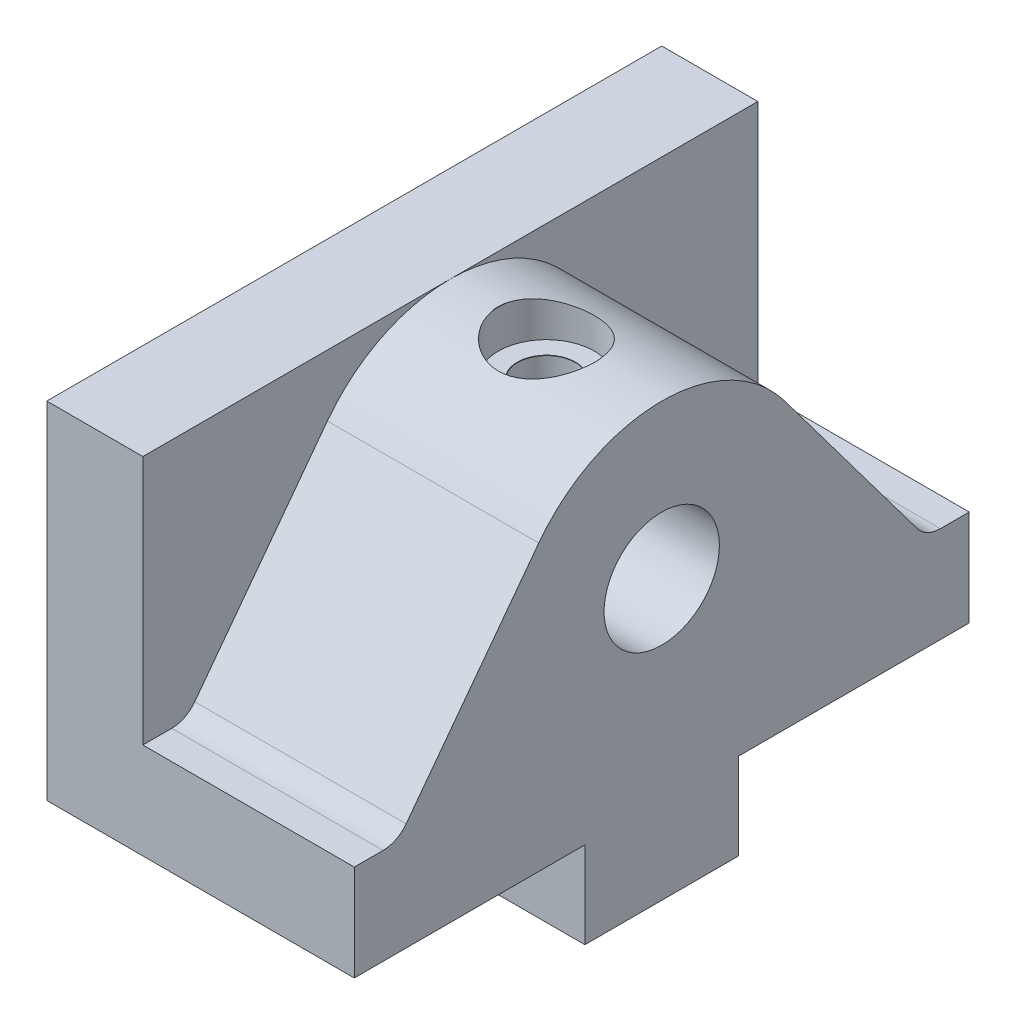
from build123d import *

# Parameters (mm, degrees)
BOSS_EXTRUDE1_DEPTH = 10
BOSS_EXTRUDE2_DEPTH = 22
SKETCH3_R           = 6
CUT_EXTRUDE1_DEPTH  = 24
LPATTERN1_COUNT     = 2
LPATTERN1_PITCH     = 16
FILLET1_R           = 3


# Read off the part's stored shape, not the designer's step: CBORE for M5 Hex Head Bolt1
with BuildPart() as part:
    # Sketch1 → Boss-Extrude1 (new body)
    with BuildSketch(Plane(origin=(0, 0, 0), x_dir=(0, 0, -1), z_dir=(1, 0, 0))):
        Polygon((-8, 0), (8, 0), (8, 9), (32, 9), (32, 45), (-32, 45), (-32, 9), (-8, 9), align=None)
    extrude(amount=BOSS_EXTRUDE1_DEPTH)

    # Sketch2 → Boss-Extrude2 (add)
    with BuildSketch(Plane(origin=(10, 0, 0), x_dir=(0, 0, -1), z_dir=(1, 0, 0))):
        with BuildLine():
            Line((-32, 9), (-32, 19))
            Line((-32, 19), (-27.5, 19))
            Line((-27.5, 19), (-12.799996672, 38.599999783))
            ThreePointArc((-12.799996672, 38.599999783), (0, 44.999997208), (12.799996672, 38.599999783))
            Line((12.799996672, 38.599999783), (27.5, 19))
            Line((27.5, 19), (32, 19))
            Line((32, 19), (32, 9))
            Line((32, 9), (8, 9))
            Line((8, 9), (8, 0))
            Line((8, 0), (-8, 0))
            Line((-8, 0), (-8, 9))
            Line((-8, 9), (-32, 9))
        make_face()
    extrude(amount=BOSS_EXTRUDE2_DEPTH)

    # Sketch3 → Cut-Extrude1 (cut)
    with BuildSketch(Plane(origin=(32, 0, 0), x_dir=(0, 0, -1), z_dir=(1, 0, 0))):
        with Locations((0, 29)):
            Circle(SKETCH3_R)
    extrude(amount=-CUT_EXTRUDE1_DEPTH, mode=Mode.SUBTRACT)

    # CBORE for M5 Hex Head Bolt1 outline → CBORE for M5 Hex Head Bolt1 (revolve, cut)
    with BuildSketch(Plane(origin=(20, 0, 0), x_dir=(1, 0, 0), z_dir=(0, 0, 1))):
        Polygon((3.025, 41), (5, 41), (5, 44.975), (5.025014792, 45.000014792), (0, 45.000014792), (0, 34.195854076), (3, 34.195854076), (3, 40.975), align=None)
    revolve(axis=Axis((20, 0, 0), (0, 1, 0)), mode=Mode.SUBTRACT)

    # Sketch9 → Ø1.0mm Dowel Hole1 (revolve, cut)
    with BuildSketch(Plane(origin=(24, 0, 0), x_dir=(0, 0, -1), z_dir=(1, 0, 0))):
        Polygon((0, 0), (0, 17.732050808), (3, 16), (3, 2.025), (5.025, 0), align=None)
    f_1_0mm_dowel_hole1 = revolve(axis=Axis((24, -6.35, 0), (0, 1, 0)), mode=Mode.SUBTRACT)

    # LPattern1: Ø1.0mm Dowel Hole1 ×2
    with Locations(*[(-i * LPATTERN1_PITCH, 0, 0) for i in range(1, LPATTERN1_COUNT)]):
        add(f_1_0mm_dowel_hole1, mode=Mode.SUBTRACT)

    # Fillet1
    fillet1_edges = [part.edges().sort_by_distance(p)[0] for p in [
        (21, 19, 27.5),
        (21, 19, -27.5),
    ]]
    fillet(fillet1_edges, radius=FILLET1_R)


solid = part.part
